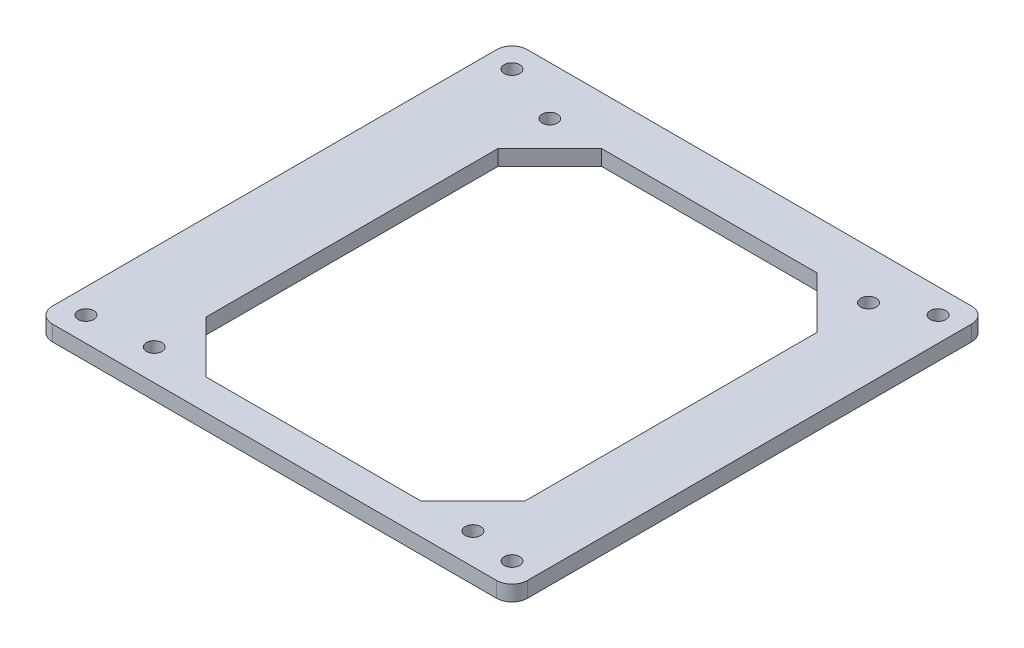
from build123d import *

# Parameters (mm, degrees)
SKETCH_1_W          = 92
SKETCH_1_H          = 92
SKETCH_1_R          = 1.5
EXTRUDE_1_DEPTH     = 3
F_3_0MM_1_D         = 3
CUT_EXTRUDE_1_DEPTH = 66.122960621
FILLET_1_R          = 3


with BuildPart() as part:
    # 草圖1 → 填料-伸長1 (new body)
    with BuildSketch(Plane(origin=(0, 0, 0), x_dir=(1, 0, 0), z_dir=(0, 1, 0))):
        Rectangle(SKETCH_1_W, SKETCH_1_H)
        with Locations((-41.25, 41.25)):
            Circle(SKETCH_1_R, mode=Mode.SUBTRACT)
        with Locations((41.25, 41.25)):
            Circle(SKETCH_1_R, mode=Mode.SUBTRACT)
        with Locations((41.25, -41.25)):
            Circle(SKETCH_1_R, mode=Mode.SUBTRACT)
        with Locations((-41.25, -41.25)):
            Circle(SKETCH_1_R, mode=Mode.SUBTRACT)
    extrude(amount=EXTRUDE_1_DEPTH)

    # Ø3.0mm 定位孔1 (through all)
    with Locations(Plane(origin=(-29.285, 3, -36.6), x_dir=(0, 0, 1), z_dir=(0, 1, 0))):
        with Locations((0, 0), (0, 61.72), (76.6, 61.72), (76.6, 0)):
            Hole(F_3_0MM_1_D / 2)

    # 草圖4 → 除料-伸長1 (cut, through all)
    with BuildSketch(Plane(origin=(0, 3, 0), x_dir=(1, 0, 0), z_dir=(0, 1, 0))):
        Polygon((-29.285, 26.6), (-19.285, 36.6), (22.435, 36.6), (32.435, 26.6), (32.435, -30), (22.435, -40), (-19.285, -40), (-29.285, -30), align=None)
    extrude(amount=-CUT_EXTRUDE_1_DEPTH, mode=Mode.SUBTRACT)

    # 圓角1
    fillet_1_edges = [part.edges().sort_by_distance(p)[0] for p in [
        (-46, 1.5, 46),
        (46, 1.5, 46),
        (46, 1.5, -46),
        (-46, 1.5, -46),
    ]]
    fillet(fillet_1_edges, radius=FILLET_1_R)


solid = part.part
